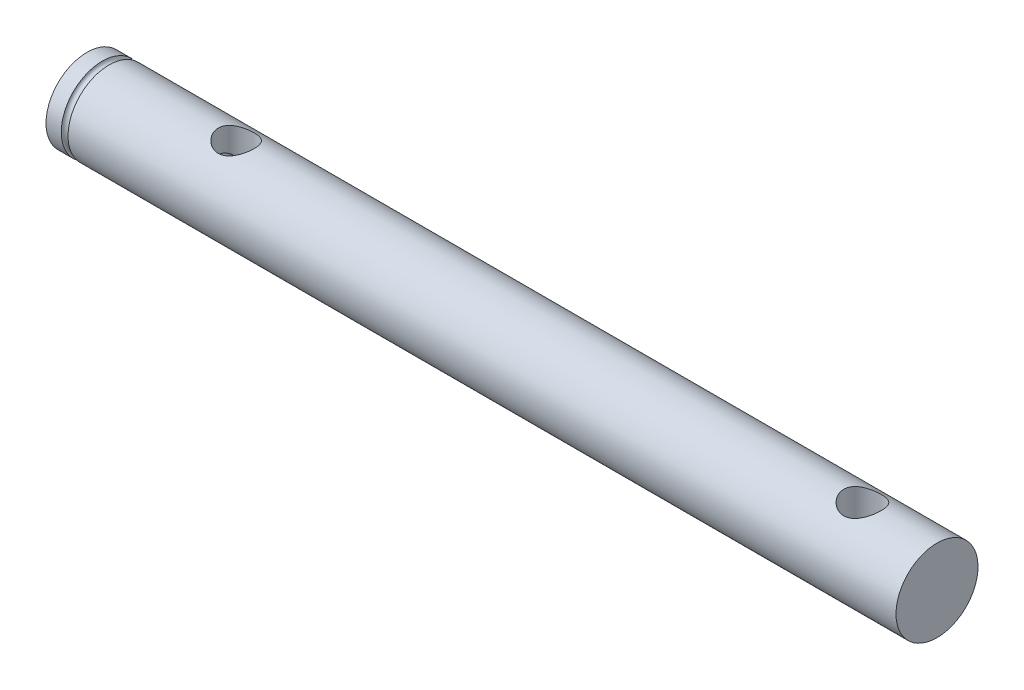
from build123d import *

# Parameters (mm, degrees)
ESBO_O9_W                  = 4
ESBO_O9_H                  = 15
CORTE_EXTRUS_O5_DEPTH      = 229.530085547
ESBO_O10_W                 = 3
ESBO_O10_H                 = 11
CORTE_EXTRUS_O6_DEPTH      = 229.530085556
CORTE_EXTRUS_O7_DEPTH      = 229.530085556
CORTE_EXTRUS_O7_DEPTH_BACK = 4.8
ESBO_O12_R                 = 4.8
ESBO_O16_R                 = 0.9
CORTE_EXTRUS_O10_DEPTH     = 229.530085656
ESBO_O17_R                 = 5
CORTE_EXTRUS_O11_DEPTH     = 11


with BuildPart() as part:
    # Esboço1 → Revolução1 (revolve)
    with BuildSketch(Plane.XY):
        with BuildLine():
            Line((40, 0), (228, 0))
            Line((228, 0), (228, 11))
            Line((228, 11), (5.9, 11))
            ThreePointArc((5.9, 11), (5, 10.1), (4.1, 11))
            Line((4.1, 11), (0, 11))
            Line((0, 11), (0, 5.5))
            Line((0, 5.5), (3, 5.5))
            Line((3, 5.5), (3, 7.5))
            Line((3, 7.5), (7, 7.5))
            Line((7, 7.5), (7, 4.8))
            Line((7, 4.8), (40, 4.8))
            Line((40, 4.8), (40, 0))
        make_face()
    revolve(axis=Axis((40, 0, 0), (1, 0, 0)))

    # Esboço9 → Corte-extrusão5 (cut, through all)
    with BuildSketch(Plane.XY):
        with Locations((5, 0)):
            Rectangle(ESBO_O9_W, ESBO_O9_H)
    extrude(amount=-CORTE_EXTRUS_O5_DEPTH, mode=Mode.SUBTRACT)

    # Esboço10 → Corte-extrusão6 (cut, through all)
    with BuildSketch(Plane.XY):
        with Locations((1.5, 0)):
            Rectangle(ESBO_O10_W, ESBO_O10_H)
    extrude(amount=-CORTE_EXTRUS_O6_DEPTH, mode=Mode.SUBTRACT)

    # Esboço12 → Corte-extrusão7 (cut, two sides: drawn at the far end of the back side and taken through both)
    with BuildSketch(Plane(origin=(0, 0, 0), x_dir=(1, 0, 0), z_dir=(0, 1, 0)).offset(-CORTE_EXTRUS_O7_DEPTH_BACK)):
        with Locations((40, 0)):
            Circle(ESBO_O12_R)
    extrude(amount=CORTE_EXTRUS_O7_DEPTH + CORTE_EXTRUS_O7_DEPTH_BACK, mode=Mode.SUBTRACT)

    # Esboço16 → Corte-extrusão10 (cut, through all)
    with BuildSketch(Plane(origin=(0, 0, 0), x_dir=(1, 0, 0), z_dir=(0, 1, 0))):
        with Locations((5, 5)):
            Circle(ESBO_O16_R)
    extrude(amount=-CORTE_EXTRUS_O10_DEPTH, mode=Mode.SUBTRACT)

    # Esboço17 → Corte-extrusão11 (cut, symmetric)
    with BuildSketch(Plane(origin=(0, 0, 0), x_dir=(1, 0, 0), z_dir=(0, 1, 0))):
        with Locations((208, 0)):
            Circle(ESBO_O17_R)
    extrude(amount=CORTE_EXTRUS_O11_DEPTH, both=True, mode=Mode.SUBTRACT)


solid = part.part
